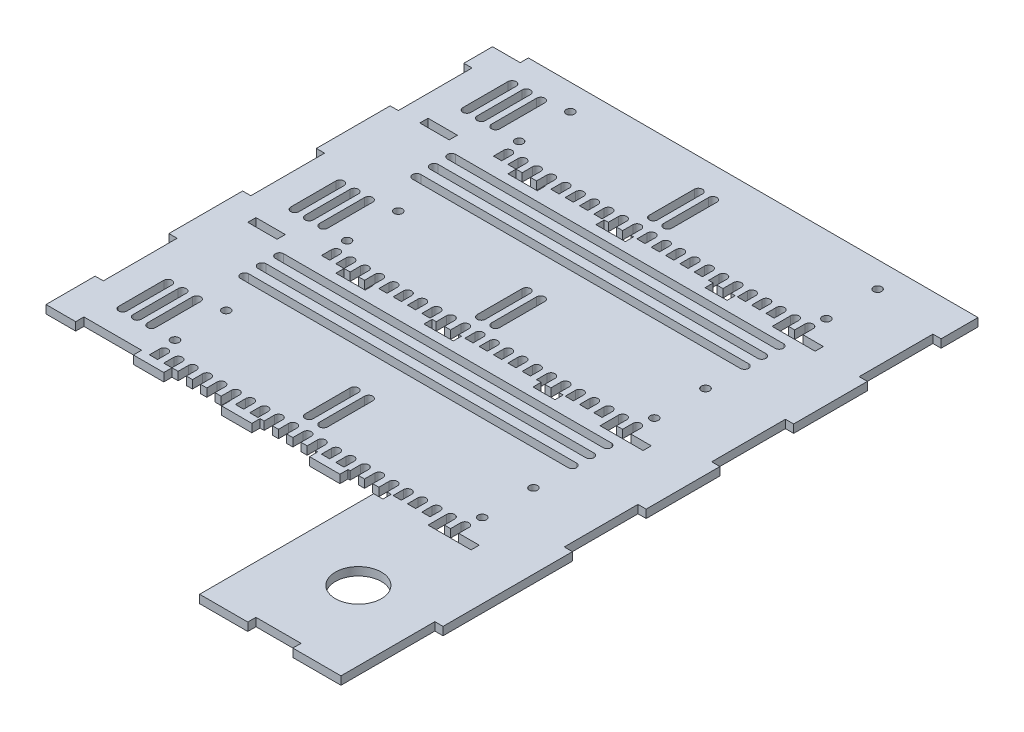
from build123d import *

# Parameters (mm, degrees)
SKETCH1_W           = 233
SKETCH1_H           = 307
BOSS_EXTRUDE1_DEPTH = 4
SKETCH2_R           = 11.25
CUT_EXTRUDE1_DEPTH  = 386.427035897
SKETCH3_W           = 160
SKETCH3_H           = 85
CUT_EXTRUDE2_DEPTH  = 4
SKETCH5_W           = 9.5
SKETCH5_H           = 4
CUT_EXTRUDE4_DEPTH  = 4
SKETCH6_W           = 4
SKETCH6_H           = 45.83
CUT_EXTRUDE6_DEPTH  = 4
SKETCH9_W           = 22
SKETCH9_H           = 4
CUT_EXTRUDE7_DEPTH  = 4
SKETCH10_W          = 21
SKETCH10_H          = 4
CUT_EXTRUDE8_DEPTH  = 4
SKETCH11_W          = 13.83333
SKETCH11_H          = 4
CUT_EXTRUDE9_DEPTH  = 4
SKETCH14_W          = 6.67
SKETCH14_H          = 4
SKETCH14_W_2        = 10.25
BOSS_EXTRUDE2_DEPTH = 4
SKETCH15_W          = 4
SKETCH15_H          = 36
CUT_EXTRUDE11_DEPTH = 4
SKETCH16_W          = 4
SKETCH16_H          = 36
CUT_EXTRUDE12_DEPTH = 4
CUT_EXTRUDE10_DEPTH = 4
LPATTERN1_COUNT     = 3
LPATTERN1_PITCH     = 84
CUT_EXTRUDE13_DEPTH = 4
LPATTERN2_COUNT     = 2
LPATTERN2_PITCH     = 84
SKETCH18_R          = 2
CUT_EXTRUDE14_DEPTH = 4
LPATTERN3_COUNT     = 3
LPATTERN3_PITCH     = 84
SKETCH19_W          = 4
SKETCH19_H          = 4
CUT_EXTRUDE15_DEPTH = 4


with BuildPart() as part:
    # Sketch1 → Boss-Extrude1 (new body)
    with BuildSketch(Plane(origin=(0, 0, 0), x_dir=(1, 0, 0), z_dir=(0, 1, 0))):
        with Locations((116.5, 153.5)):
            Rectangle(SKETCH1_W, SKETCH1_H)
    extrude(amount=BOSS_EXTRUDE1_DEPTH)

    # Sketch2 → Cut-Extrude1 (cut, through all)
    with BuildSketch(Plane(origin=(0, 4, 0), x_dir=(1, 0, 0), z_dir=(0, 1, 0))):
        with Locations((195, 42.5)):
            Circle(SKETCH2_R)
    extrude(amount=-CUT_EXTRUDE1_DEPTH, mode=Mode.SUBTRACT)

    # Sketch3 → Cut-Extrude2 (cut)
    with BuildSketch(Plane(origin=(0, 4, 0), x_dir=(1, 0, 0), z_dir=(0, 1, 0))):
        with Locations((80, 42.5)):
            Rectangle(SKETCH3_W, SKETCH3_H)
    extrude(amount=-CUT_EXTRUDE2_DEPTH, mode=Mode.SUBTRACT)

    # Sketch5 → Cut-Extrude4 (cut)
    with BuildSketch(Plane.XZ):
        with Locations((8.75, -305)):
            Rectangle(SKETCH5_W, SKETCH5_H)
    extrude(amount=-CUT_EXTRUDE4_DEPTH, mode=Mode.SUBTRACT)

    # Sketch6 → Cut-Extrude6 (cut)
    with BuildSketch(Plane(origin=(0, 0, 0), x_dir=(-1, 0, 0), z_dir=(0, -1, 0))):
        with Locations((-231, 22.915)):
            Rectangle(SKETCH6_W, SKETCH6_H)
    extrude(amount=-CUT_EXTRUDE6_DEPTH, mode=Mode.SUBTRACT)

    # Sketch9 → Cut-Extrude7 (cut)
    with BuildSketch(Plane(origin=(0, 4, 0), x_dir=(1, 0, 0), z_dir=(0, 1, 0))):
        with Locations((194.5, 2)):
            Rectangle(SKETCH9_W, SKETCH9_H)
    extrude(amount=-CUT_EXTRUDE7_DEPTH, mode=Mode.SUBTRACT)

    # Sketch10 → Cut-Extrude8 (cut)
    with BuildSketch(Plane(origin=(0, 4, 0), x_dir=(1, 0, 0), z_dir=(0, 1, 0))):
        with Locations((68, 87)):
            Rectangle(SKETCH10_W, SKETCH10_H)
        with Locations((25, 87)):
            Rectangle(SKETCH10_W, SKETCH10_H)
        with Locations((111, 87)):
            Rectangle(SKETCH10_W, SKETCH10_H)
        with Locations((154, 87)):
            Rectangle(SKETCH10_W, SKETCH10_H)
        with Locations((197, 87)):
            Rectangle(SKETCH10_W, SKETCH10_H)
        with Locations((68, 171)):
            Rectangle(SKETCH10_W, SKETCH10_H)
        with Locations((25, 171)):
            Rectangle(SKETCH10_W, SKETCH10_H)
        with Locations((111, 171)):
            Rectangle(SKETCH10_W, SKETCH10_H)
        with Locations((154, 171)):
            Rectangle(SKETCH10_W, SKETCH10_H)
        with Locations((197, 171)):
            Rectangle(SKETCH10_W, SKETCH10_H)
        with Locations((68, 255)):
            Rectangle(SKETCH10_W, SKETCH10_H)
        with Locations((25, 255)):
            Rectangle(SKETCH10_W, SKETCH10_H)
        with Locations((111, 255)):
            Rectangle(SKETCH10_W, SKETCH10_H)
        with Locations((154, 255)):
            Rectangle(SKETCH10_W, SKETCH10_H)
        with Locations((197, 255)):
            Rectangle(SKETCH10_W, SKETCH10_H)
    extrude(amount=-CUT_EXTRUDE8_DEPTH, mode=Mode.SUBTRACT)

    # Sketch11 → Cut-Extrude9 (cut)
    with BuildSketch(Plane(origin=(0, 4, 0), x_dir=(1, 0, 0), z_dir=(0, 1, 0))):
        with Locations((35.750335, 87)):
            Rectangle(SKETCH11_W, SKETCH11_H)
        with Locations((78.750335, 87)):
            Rectangle(SKETCH11_W, SKETCH11_H)
        with Locations((121.750335, 87)):
            Rectangle(SKETCH11_W, SKETCH11_H)
    extrude(amount=-CUT_EXTRUDE9_DEPTH, mode=Mode.SUBTRACT)

    # Sketch14 → Boss-Extrude2 (add)
    with BuildSketch(Plane(origin=(0, 4, 0), x_dir=(1, 0, 0), z_dir=(0, 1, 0))):
        with Locations((32.165, 171)):
            Rectangle(SKETCH14_W, SKETCH14_H)
        with Locations((75.165, 171)):
            Rectangle(SKETCH14_W, SKETCH14_H)
        with Locations((118.165, 171)):
            Rectangle(SKETCH14_W, SKETCH14_H)
        with Locations((148.625, 171)):
            Rectangle(SKETCH14_W_2, SKETCH14_H)
        with Locations((148.625, 255)):
            Rectangle(SKETCH14_W_2, SKETCH14_H)
        with Locations((32.165, 255)):
            Rectangle(SKETCH14_W, SKETCH14_H)
        with Locations((75.165, 255)):
            Rectangle(SKETCH14_W, SKETCH14_H)
        with Locations((118.165, 255)):
            Rectangle(SKETCH14_W, SKETCH14_H)
    extrude(amount=-BOSS_EXTRUDE2_DEPTH)

    # Sketch15 → Cut-Extrude11 (cut)
    with BuildSketch(Plane(origin=(0, 4, 0), x_dir=(1, 0, 0), z_dir=(0, 1, 0))):
        with Locations((2, 271)):
            Rectangle(SKETCH15_W, SKETCH15_H)
        with Locations((2, 199)):
            Rectangle(SKETCH15_W, SKETCH15_H)
        with Locations((2, 127)):
            Rectangle(SKETCH15_W, SKETCH15_H)
    extrude(amount=-CUT_EXTRUDE11_DEPTH, mode=Mode.SUBTRACT)

    # Sketch16 → Cut-Extrude12 (cut)
    with BuildSketch(Plane(origin=(0, 4, 0), x_dir=(1, 0, 0), z_dir=(0, 1, 0))):
        with Locations((231, 271)):
            Rectangle(SKETCH16_W, SKETCH16_H)
        with Locations((231, 199)):
            Rectangle(SKETCH16_W, SKETCH16_H)
        with Locations((231, 127)):
            Rectangle(SKETCH16_W, SKETCH16_H)
    extrude(amount=-CUT_EXTRUDE12_DEPTH, mode=Mode.SUBTRACT)

    # Sketch12 → Cut-Extrude10 (cut)
    with BuildSketch(Plane(origin=(0, 4, 0), x_dir=(1, 0, 0), z_dir=(0, 1, 0))):
        with BuildLine():
            Line((22.5, 292), (22.5, 270))
            ThreePointArc((22.5, 270), (20.5, 268), (18.5, 270))
            Line((18.5, 270), (18.5, 292))
            ThreePointArc((18.5, 292), (20.5, 294), (22.5, 292))
        make_face()
        with BuildLine():
            Line((113.5, 292), (113.5, 270))
            ThreePointArc((113.5, 270), (111.5, 268), (109.5, 270))
            Line((109.5, 270), (109.5, 292))
            ThreePointArc((109.5, 292), (111.5, 294), (113.5, 292))
        make_face()
        with BuildLine():
            Line((120.5, 292), (120.5, 270))
            ThreePointArc((120.5, 270), (118.5, 268), (116.5, 270))
            Line((116.5, 270), (116.5, 292))
            ThreePointArc((116.5, 292), (118.5, 294), (120.5, 292))
        make_face()
        with BuildLine():
            Line((109.5, 256.97), (113.5, 256.97))
            Line((113.5, 256.97), (113.5, 262))
            ThreePointArc((113.5, 262), (111.5, 264), (109.5, 262))
            Line((109.5, 262), (109.5, 256.97))
        make_face()
        with BuildLine():
            Line((25.5, 292), (25.5, 270))
            ThreePointArc((25.5, 270), (27.5, 268), (29.5, 270))
            Line((29.5, 270), (29.5, 292))
            ThreePointArc((29.5, 292), (27.5, 294), (25.5, 292))
        make_face()
        with BuildLine():
            Line((36.5, 292), (36.5, 270))
            ThreePointArc((36.5, 270), (34.5, 268), (32.5, 270))
            Line((32.5, 270), (32.5, 292))
            ThreePointArc((32.5, 292), (34.5, 294), (36.5, 292))
        make_face()
        with BuildLine():
            Line((102.5, 262), (102.5, 256.97))
            Line((102.5, 256.97), (106.5, 256.97))
            Line((106.5, 256.97), (106.5, 262))
            ThreePointArc((106.5, 262), (104.5, 264), (102.5, 262))
        make_face()
        with BuildLine():
            Line((95.5, 262), (95.5, 256.97))
            Line((95.5, 256.97), (99.5, 256.97))
            Line((99.5, 256.97), (99.5, 262))
            ThreePointArc((99.5, 262), (97.5, 264), (95.5, 262))
        make_face()
        with BuildLine():
            Line((88.5, 262), (88.5, 256.97))
            Line((88.5, 256.97), (92.5, 256.97))
            Line((92.5, 256.97), (92.5, 262))
            ThreePointArc((92.5, 262), (90.5, 264), (88.5, 262))
        make_face()
        with BuildLine():
            Line((81.5, 262), (81.5, 256.97))
            Line((81.5, 256.97), (85.5, 256.97))
            Line((85.5, 256.97), (85.5, 262))
            ThreePointArc((85.5, 262), (83.5, 264), (81.5, 262))
        make_face()
        with BuildLine():
            Line((74.5, 262), (74.5, 256.97))
            Line((74.5, 256.97), (78.5, 256.97))
            Line((78.5, 256.97), (78.5, 262))
            ThreePointArc((78.5, 262), (76.5, 264), (74.5, 262))
        make_face()
        with BuildLine():
            Line((67.5, 262), (67.5, 256.97))
            Line((67.5, 256.97), (71.5, 256.97))
            Line((71.5, 256.97), (71.5, 262))
            ThreePointArc((71.5, 262), (69.5, 264), (67.5, 262))
        make_face()
        with BuildLine():
            Line((60.5, 262), (60.5, 256.97))
            Line((60.5, 256.97), (64.5, 256.97))
            Line((64.5, 256.97), (64.5, 262))
            ThreePointArc((64.5, 262), (62.5, 264), (60.5, 262))
        make_face()
        with BuildLine():
            Line((53.5, 262), (53.5, 256.97))
            Line((53.5, 256.97), (57.5, 256.97))
            Line((57.5, 256.97), (57.5, 262))
            ThreePointArc((57.5, 262), (55.5, 264), (53.5, 262))
        make_face()
        with BuildLine():
            Line((116.5, 262), (116.5, 256.97))
            Line((116.5, 256.97), (120.5, 256.97))
            Line((120.5, 256.97), (120.5, 262))
            ThreePointArc((120.5, 262), (118.5, 264), (116.5, 262))
        make_face()
        with BuildLine():
            Line((123.5, 262), (123.5, 256.97))
            Line((123.5, 256.97), (127.5, 256.97))
            Line((127.5, 256.97), (127.5, 262))
            ThreePointArc((127.5, 262), (125.5, 264), (123.5, 262))
        make_face()
        with BuildLine():
            Line((130.5, 262), (130.5, 256.97))
            Line((130.5, 256.97), (134.5, 256.97))
            Line((134.5, 256.97), (134.5, 262))
            ThreePointArc((134.5, 262), (132.5, 264), (130.5, 262))
        make_face()
        with BuildLine():
            Line((137.5, 262), (137.5, 256.97))
            Line((137.5, 256.97), (141.5, 256.97))
            Line((141.5, 256.97), (141.5, 262))
            ThreePointArc((141.5, 262), (139.5, 264), (137.5, 262))
        make_face()
        with BuildLine():
            Line((144.5, 262), (144.5, 256.97))
            Line((144.5, 256.97), (148.5, 256.97))
            Line((148.5, 256.97), (148.5, 262))
            ThreePointArc((148.5, 262), (146.5, 264), (144.5, 262))
        make_face()
        with BuildLine():
            Line((151.5, 262), (151.5, 256.97))
            Line((151.5, 256.97), (155.5, 256.97))
            Line((155.5, 256.97), (155.5, 262))
            ThreePointArc((155.5, 262), (153.5, 264), (151.5, 262))
        make_face()
        with BuildLine():
            Line((158.5, 262), (158.5, 256.97))
            Line((158.5, 256.97), (162.5, 256.97))
            Line((162.5, 256.97), (162.5, 262))
            ThreePointArc((162.5, 262), (160.5, 264), (158.5, 262))
        make_face()
        with BuildLine():
            Line((165.5, 262), (165.5, 256.97))
            Line((165.5, 256.97), (169.5, 256.97))
            Line((169.5, 256.97), (169.5, 262))
            ThreePointArc((169.5, 262), (167.5, 264), (165.5, 262))
        make_face()
        with BuildLine():
            Line((172.5, 262), (172.5, 256.97))
            Line((172.5, 256.97), (176.5, 256.97))
            Line((176.5, 256.97), (176.5, 262))
            ThreePointArc((176.5, 262), (174.5, 264), (172.5, 262))
        make_face()
        with BuildLine():
            Line((179.5, 262), (179.5, 256.97))
            Line((179.5, 256.97), (183.5, 256.97))
            Line((183.5, 256.97), (183.5, 262))
            ThreePointArc((183.5, 262), (181.5, 264), (179.5, 262))
        make_face()
        with BuildLine():
            Line((186.5, 262), (186.5, 256.97))
            Line((186.5, 256.97), (190.5, 256.97))
            Line((190.5, 256.97), (190.5, 262))
            ThreePointArc((190.5, 262), (188.5, 264), (186.5, 262))
        make_face()
        with BuildLine():
            Line((46.5, 262), (46.5, 256.97))
            Line((46.5, 256.97), (50.5, 256.97))
            Line((50.5, 256.97), (50.5, 262))
            ThreePointArc((50.5, 262), (48.5, 264), (46.5, 262))
        make_face()
        with BuildLine():
            Line((193.5, 262), (193.5, 256.97))
            Line((193.5, 256.97), (197.5, 256.97))
            Line((197.5, 256.97), (197.5, 262))
            ThreePointArc((197.5, 262), (195.5, 264), (193.5, 262))
        make_face()
    cut_extrude10 = extrude(amount=-CUT_EXTRUDE10_DEPTH, mode=Mode.SUBTRACT)

    # LPattern1: Cut-Extrude10 ×3
    with Locations(*[(0, 0, i * LPATTERN1_PITCH) for i in range(1, LPATTERN1_COUNT)]):
        add(cut_extrude10, mode=Mode.SUBTRACT)

    # Sketch17 → Cut-Extrude13 (cut)
    with BuildSketch(Plane(origin=(0, 4, 0), x_dir=(1, 0, 0), z_dir=(0, 1, 0))):
        with BuildLine():
            Line((196.5, 160.47), (36.5, 160.47))
            ThreePointArc((36.5, 160.47), (34.5, 162.47), (36.5, 164.47))
            Line((36.5, 164.47), (196.5, 164.47))
            ThreePointArc((196.5, 164.47), (198.5, 162.47), (196.5, 160.47))
        make_face()
        with BuildLine():
            Line((196.5, 155.97), (36.5, 155.97))
            ThreePointArc((36.5, 155.97), (34.5, 153.97), (36.5, 151.97))
            Line((36.5, 151.97), (196.5, 151.97))
            ThreePointArc((196.5, 151.97), (198.5, 153.97), (196.5, 155.97))
        make_face()
        with BuildLine():
            Line((196.5, 147.47), (36.5, 147.47))
            ThreePointArc((36.5, 147.47), (34.5, 145.47), (36.5, 143.47))
            Line((36.5, 143.47), (196.5, 143.47))
            ThreePointArc((196.5, 143.47), (198.5, 145.47), (196.5, 147.47))
        make_face()
    cut_extrude13 = extrude(amount=-CUT_EXTRUDE13_DEPTH, mode=Mode.SUBTRACT)

    # LPattern2: Cut-Extrude13 ×2
    with Locations(*[(0, 0, -i * LPATTERN2_PITCH) for i in range(1, LPATTERN2_COUNT)]):
        add(cut_extrude13, mode=Mode.SUBTRACT)

    # Sketch18 → Cut-Extrude14 (cut)
    with BuildSketch(Plane(origin=(0, 4, 0), x_dir=(1, 0, 0), z_dir=(0, 1, 0))):
        with Locations((196.5, 269.47)):
            Circle(SKETCH18_R)
        with Locations((46.5, 269.47)):
            Circle(SKETCH18_R)
        with Locations((46.5, 294.47)):
            Circle(SKETCH18_R)
        with Locations((196.5, 294.47)):
            Circle(SKETCH18_R)
    cut_extrude14 = extrude(amount=-CUT_EXTRUDE14_DEPTH, mode=Mode.SUBTRACT)

    # LPattern3: Cut-Extrude14 ×3
    with Locations(*[(0, 0, i * LPATTERN3_PITCH) for i in range(1, LPATTERN3_COUNT)]):
        add(cut_extrude14, mode=Mode.SUBTRACT)

    # Sketch19 → Cut-Extrude15 (cut)
    with BuildSketch(Plane(origin=(0, 0, -307), x_dir=(-1, 0, 0), z_dir=(0, 0, -1))):
        with Locations((-2, 2)):
            Rectangle(SKETCH19_W, SKETCH19_H)
    extrude(amount=-CUT_EXTRUDE15_DEPTH, mode=Mode.SUBTRACT)


solid = part.part
